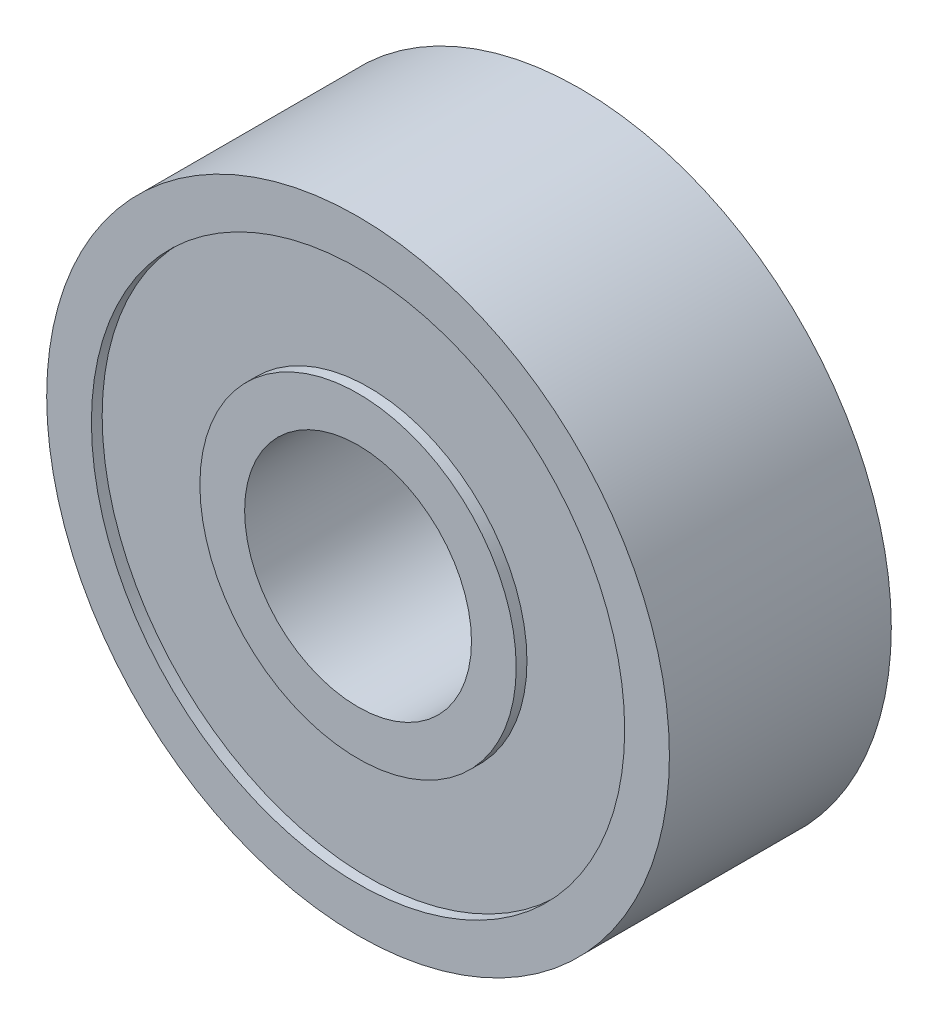
from build123d import *

# Parameters (mm, degrees)
SKETCH1_R           = 11.049
SKETCH1_R_2         = 4.025
BOSS_EXTRUDE1_DEPTH = 3.937
SKETCH2_R           = 9.4615
SKETCH2_R_2         = 5.6125
CUT_EXTRUDE1_DEPTH  = 0.381


with BuildPart() as part:
    # Sketch1 → Boss-Extrude1 (new, symmetric)
    with BuildSketch(Plane.XY):
        Circle(SKETCH1_R)
        Circle(SKETCH1_R_2, mode=Mode.SUBTRACT)
    extrude(amount=BOSS_EXTRUDE1_DEPTH, both=True)

    # Sketch2 → Cut-Extrude1 (cut)
    with BuildSketch(Plane.XY.offset(3.937)):
        Circle(SKETCH2_R)
        Circle(SKETCH2_R_2, mode=Mode.SUBTRACT)
    cut_extrude1 = extrude(amount=-CUT_EXTRUDE1_DEPTH, mode=Mode.SUBTRACT)

    # Mirror1: Cut-Extrude1 across plane
    add(cut_extrude1.mirror(Plane.XY), mode=Mode.SUBTRACT)


solid = part.part
